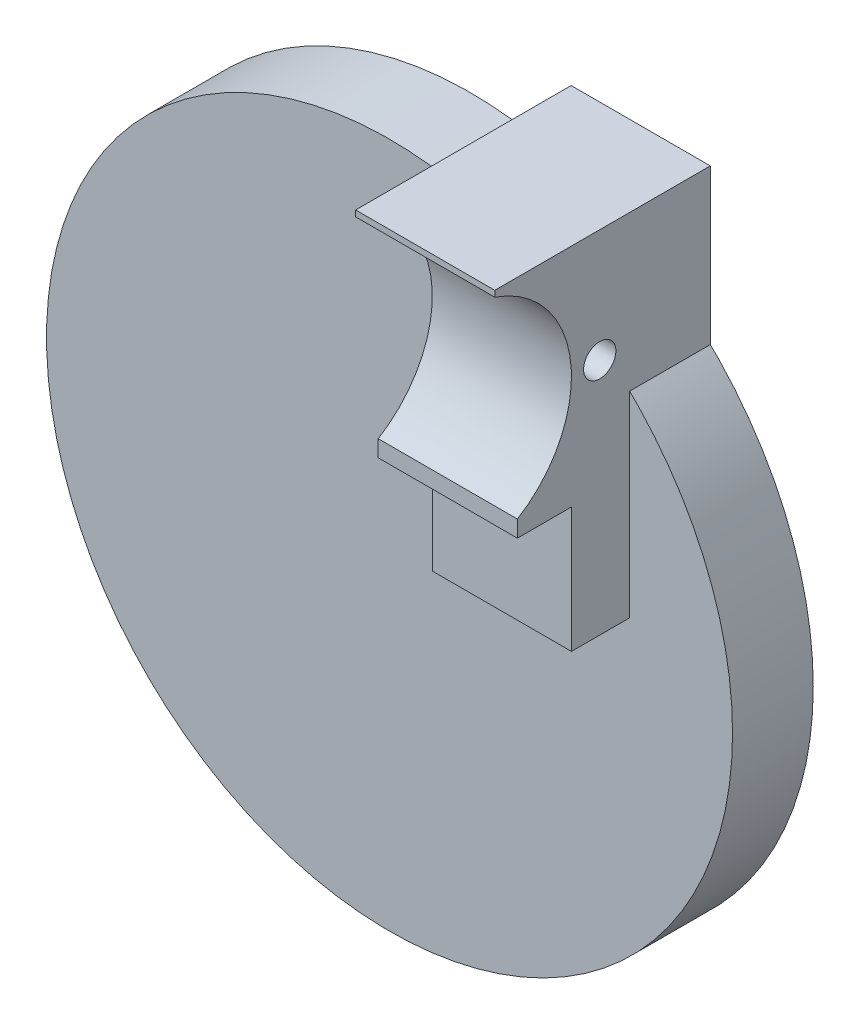
from build123d import *

# Parameters (mm, degrees)
SKETCH4_R               = 42.5
BASE_DEPTH              = 10
SKETCH5_W               = 17.242861366
SKETCH5_H               = 43.5
BOSS_EXTRUDE1_DEPTH     = 17.2
SKETCH6_W               = 13.242861366
SKETCH6_H               = 13.2
CUT_EXTRUDE1_DEPTH      = 24
SKETCH9_R               = 1.5
BOSS_EXTRUDE2_DEPTH     = 5
WRAP1_START             = -22.242861366
WRAP1_OUTLINE_R         = 1.5
WRAP1_DEPTH             = 5
SKETCH14_W              = 14
SKETCH14_H              = 28
BOSS_EXTRUDE4_DEPTH     = 17.242861366
SKETCH16_R              = 14
CUT_EXTRUDE2_DEPTH      = 17.242861366
CUT_EXTRUDE4_REACH      = 108.036
SKETCH19_W              = 17.242861366
SKETCH19_H              = 4.5
CUT_EXTRUDE6_REACH      = 71.795
CUT_EXTRUDE6_END_RADIUS = 14
SKETCH22_W              = 17.242861366
SKETCH22_H              = 2.8
SKETCH23_R              = 2
CUT_EXTRUDE7_DEPTH      = 17.242861366


# Read off the part's stored shape, not the designer's step: Wrap1
with BuildPart() as part:
    # Sketch4 → base (new body)
    with BuildSketch(Plane.XY):
        Circle(SKETCH4_R)
    extrude(amount=BASE_DEPTH)


with BuildPart() as body_2:
    # Sketch5 → Boss-Extrude1 (new body)
    with BuildSketch(Plane.XY):
        with Locations((21.121430683, 27.75)):
            Rectangle(SKETCH5_W, SKETCH5_H)
    extrude(amount=BOSS_EXTRUDE1_DEPTH)

    # Sketch6 → Cut-Extrude1 (cut)
    with BuildSketch(Plane(origin=(0, 6, 0), x_dir=(-1, 0, 0), z_dir=(0, -1, 0))):
        with Locations((-21.121430683, -8.6)):
            Rectangle(SKETCH6_W, SKETCH6_H)
    extrude(amount=-CUT_EXTRUDE1_DEPTH, mode=Mode.SUBTRACT)

    # Sketch9 → Boss-Extrude2 (add)
    with BuildSketch(Plane(origin=(29.742861366, 0, 0), x_dir=(0, 0, -1), z_dir=(1, 0, 0))):
        with Locations(Location((-7.5, 18.722537456, 0), (0, 0, 180))):
            Circle(SKETCH9_R)
    extrude(amount=BOSS_EXTRUDE2_DEPTH)

    # Wrap1 outline → Wrap1 (add)
    with BuildSketch(Plane(origin=(29.742861366, 0, 0), x_dir=(0, 0, -1), z_dir=(1, 0, 0)).offset(WRAP1_START)):
        with Locations((-7.5, 18.722537456)):
            Circle(WRAP1_OUTLINE_R)
    extrude(amount=WRAP1_DEPTH)

    # Sketch14 → Boss-Extrude4 (add)
    with BuildSketch(Plane(origin=(29.742861366, 0, 0), x_dir=(0, 0, -1), z_dir=(1, 0, 0))):
        with Locations((-24.2, 35.5)):
            Rectangle(SKETCH14_W, SKETCH14_H)
    extrude(amount=-BOSS_EXTRUDE4_DEPTH)

    # Sketch16 → Cut-Extrude2 (cut)
    with BuildSketch(Plane(origin=(29.742861366, 0, 0), x_dir=(0, 0, -1), z_dir=(1, 0, 0))):
        with Locations((-31.2, 35.5)):
            Circle(SKETCH16_R)
    extrude(amount=-CUT_EXTRUDE2_DEPTH, mode=Mode.SUBTRACT)

    # Cut-Extrude4: up to this face of the body (flat: up to its plane)
    cut_extrude4_end = Plane(body_2.part.faces().sort_by_distance((21.121430683, 21.5, 24.2))[0])
    # Sketch19 → Cut-Extrude4 (cut, up to the picked face)
    with BuildSketch(Plane(origin=(0, 49.5, 0), x_dir=(1, 0, 0), z_dir=(0, 1, 0)), mode=Mode.PRIVATE) as cut_extrude4_sk1:
        with Locations((21.121430683, -28.95)):
            Rectangle(SKETCH19_W, SKETCH19_H)
    cut_extrude4_tool1 = split(extrude(cut_extrude4_sk1.sketch, amount=-CUT_EXTRUDE4_REACH, mode=Mode.PRIVATE), bisect_by=cut_extrude4_end, keep=Keep.BOTH, mode=Mode.PRIVATE)
    add(cut_extrude4_tool1.solids().sort_by(Axis((21.121431, 49.5, 28.95), (0, -1, 0)))[0], mode=Mode.SUBTRACT)

    # Cut-Extrude6: up to this cylinder (the profile starts outside it)
    cut_extrude6_end = Plane(origin=(21.121431, 35.5, 31.2), z_dir=(1, 0, 0)) * Cylinder(CUT_EXTRUDE6_END_RADIUS, 172.59, mode=Mode.PRIVATE)
    # Sketch22 → Cut-Extrude6 (cut, up to the surface)
    with BuildSketch(Plane(origin=(0, 6, 0), x_dir=(-1, 0, 0), z_dir=(0, -1, 0)), mode=Mode.PRIVATE) as cut_extrude6_sk1:
        with Locations((-21.121430683, -25.3)):
            Rectangle(SKETCH22_W, SKETCH22_H)
    cut_extrude6_tool1 = extrude(cut_extrude6_sk1.sketch, amount=-CUT_EXTRUDE6_REACH, mode=Mode.PRIVATE) - cut_extrude6_end
    add(cut_extrude6_tool1.solids().sort_by_distance((21.121431, 6, 25.3))[0], mode=Mode.SUBTRACT)

    # Sketch23 → Cut-Extrude7 (cut)
    with BuildSketch(Plane(origin=(29.742861366, 0, 0), x_dir=(0, 0, -1), z_dir=(1, 0, 0))):
        with Locations(Location((-13.7, 35.5, 0), (0, 0, 90))):
            Circle(SKETCH23_R)
    extrude(amount=-CUT_EXTRUDE7_DEPTH, mode=Mode.SUBTRACT)


solid = Compound([part.part, body_2.part])
